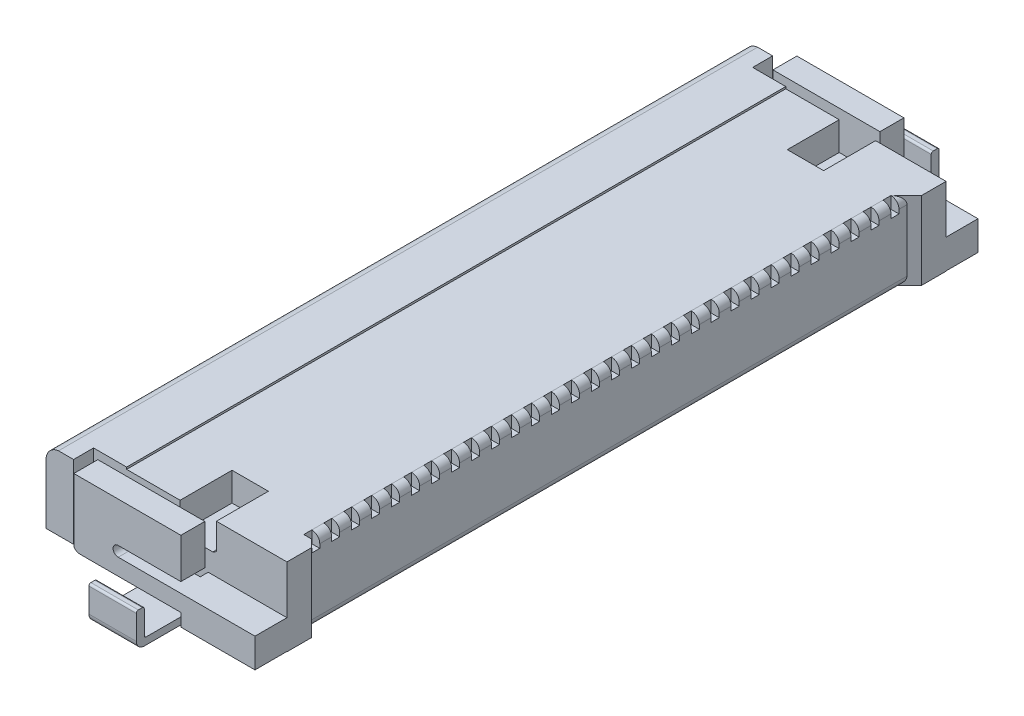
from build123d import *

# Parameters (mm, degrees)
BOSS_EXTRUDE1_DEPTH  = 0.6
BOSS_EXTRUDE2_DEPTH  = 0.8
SKETCH8_W            = 1.187106534
SKETCH8_H            = 0.413578876
BOSS_EXTRUDE3_DEPTH  = 0.6
BOSS_EXTRUDE5_DEPTH  = 1.999195913
CUT_EXTRUDE6_DEPTH   = 1.3
SKETCH19_W           = 8.25
SKETCH19_H           = 1.999195913
BOSS_EXTRUDE6_DEPTH  = 0.963004
BOSS_EXTRUDE7_DEPTH  = 8.25
CUT_EXTRUDE7_DEPTH   = 8.25
BOSS_EXTRUDE8_DEPTH  = 0.5
CUT_EXTRUDE8_DEPTH   = 0.05
FILLET4_R            = 0.2
SKETCH25_W           = 0.960524303
SKETCH25_H           = 0.2
CUT_EXTRUDE9_DEPTH   = 0.3
BOSS_EXTRUDE9_DEPTH  = 1
SKETCH27_W           = 1.187106534
SKETCH27_H           = 0.682337146
BOSS_EXTRUDE10_DEPTH = 0.2
FILLET6_R            = 0.2
FILLET7_R            = 0.05
BOSS_EXTRUDE11_DEPTH = 1.187106534
FILLET6_OF_MIRROR6_R = 0.2
FILLET7_OF_MIRROR6_R = 0.05
FILLET8_R            = 0.05
FILLET9_R            = 0.05
CUT_EXTRUDE10_DEPTH  = 0.68797799
SKETCH31_W           = 0.2
SKETCH31_H           = 0.540396383
BOSS_EXTRUDE12_DEPTH = 0.05
SKETCH32_W           = 0.2
SKETCH32_H           = 0.13319307
BOSS_EXTRUDE13_DEPTH = 0.01
LPATTERN3_COUNT      = 30
LPATTERN3_PITCH      = 0.5


with BuildPart() as part:
    # Sketch5 → Boss-Extrude1 (new body)
    with BuildSketch(Plane.XY):
        with BuildLine():
            Line((1.03647469, 0.909619652), (1.03647469, 0.476981472))
            add(Edge.make_bspline(
                [(1.184733339, 0.385802819), (1.081992039, 0.388557453), (1.03647469, 0.476981472)],
                knots=[0, 0, 0, 1, 1, 1], degree=2))
            Line((1.184733339, 0.385802819), (2.412634415, 0.385802819))
            Line((2.412634415, 0.385802819), (2.412634415, 0.799381695))
            Line((2.412634415, 0.799381695), (2.14625929, 0.799381695))
            ThreePointArc((2.14625929, 0.799381695), (2.018862492, 0.926778494), (2.14625929, 1.054175292))
            Line((2.14625929, 1.054175292), (3.715556221, 1.054175292))
            Line((3.715556221, 1.054175292), (3.715556221, 1.297888432))
            Line((3.715556221, 1.297888432), (3.715556221, 2.059195913))
            Line((3.715556221, 2.059195913), (1.03647469, 2.059195913))
            Line((1.03647469, 2.059195913), (1.03647469, 1.21340623))
            Line((1.03647469, 1.21340623), (1.03647469, 0.909619652))
        make_face()
    boss_extrude1 = extrude(amount=-BOSS_EXTRUDE1_DEPTH)



with BuildPart() as body_2:
    # Sketch7 → Boss-Extrude2 (new body)
    with BuildSketch(Plane.XY):
        Polygon((3.715556221, 0.067073076), (5.570517707, 0.067073076), (5.570517707, 0.174952185), (5.570517707, 0.799381695), (3.599740949, 0.799381695), (3.599740949, 0.385802819), (3.715556221, 0.385802819), (3.715556221, 0.174952185), align=None)
    boss_extrude2 = extrude(amount=-BOSS_EXTRUDE2_DEPTH)


with BuildPart() as part_1:
    add(part.part)

    add(body_2.part)  # Boss-Extrude3 merges body 2
    # Sketch8 → Boss-Extrude3 (add)
    with BuildSketch(Plane.XY):
        with Locations((3.006187682, 0.592592257)):
            Rectangle(SKETCH8_W, SKETCH8_H)
    boss_extrude3 = extrude(amount=-BOSS_EXTRUDE3_DEPTH)

    # Sketch13 → Boss-Extrude5 (add)
    with BuildSketch(Plane(origin=(0, 0.06, 0), x_dir=(1, 0, 0), z_dir=(0, 1, 0))):
        Polygon((5.307650665, 9.05), (1.692449276, 9.05), (1.692449276, 0.8), (5.570517707, 0.8), (5.570517707, 1.413103506), (5.3880831, 1.595538113), (5.3880831, 9.05), align=None)
    boss_extrude5 = extrude(amount=BOSS_EXTRUDE5_DEPTH)

    # Sketch17 → Cut-Extrude6 (cut)
    with BuildSketch(Plane.XY.offset(-0.8)):
        Polygon((3.806395908, 1.34820616), (3.715556221, 1.297888432), (2.896280475, 1.297888432), (2.896280475, 2.059195913), (3.806395908, 2.059195913), align=None)
    cut_extrude6 = extrude(amount=-CUT_EXTRUDE6_DEPTH, mode=Mode.SUBTRACT)



with BuildPart() as body_2_2:
    # Sketch19 → Boss-Extrude6 (new body)
    with BuildSketch(Plane.ZY.offset(-1.692449276)):
        with Locations((-4.925, 1.059597956)):
            Rectangle(SKETCH19_W, SKETCH19_H)
    boss_extrude6 = extrude(amount=BOSS_EXTRUDE6_DEPTH)

    # Sketch18 → Boss-Extrude7 (add)
    with BuildSketch(Plane.XY.offset(-0.8)):
        with BuildLine():
            Line((0.041467015, 1.670216776), (0.041467015, 0.219865316))
            Line((0.041467015, 0.219865316), (0.729445005, 0.219865316))
            Line((0.729445005, 0.219865316), (0.729445005, 0.909619652))
            Line((0.729445005, 0.909619652), (0.729445005, 2.059195913))
            Line((0.729445005, 2.059195913), (0.352729657, 2.059195913))
            ThreePointArc((0.352729657, 2.059195913), (0.116538119, 1.929170948), (0.041467015, 1.670216776))
        make_face()
    boss_extrude7 = extrude(amount=-BOSS_EXTRUDE7_DEPTH)

    # Sketch20 → Cut-Extrude7 (cut)
    with BuildSketch(Plane.XY.offset(-0.8)):
        Polygon((1.03647469, 0.067073076), (1.03647469, 0.909619652), (0.729445005, 0.909619652), (0.729445005, 0.219865316), (0.729445005, 0.06), (0.729445005, -0.020267982), (1.03647469, -0.020267982), align=None)
    cut_extrude7 = extrude(amount=-CUT_EXTRUDE7_DEPTH, mode=Mode.SUBTRACT)

    # Sketch21 → Boss-Extrude8 (add)
    with BuildSketch(Plane.XY.offset(-0.8)):
        with BuildLine():
            Line((0.729445005, 0.219865316), (0.729445005, 0.909619652))
            Line((0.729445005, 0.909619652), (0.729445005, 2.059195913))
            Line((0.729445005, 2.059195913), (0.352729657, 2.059195913))
            ThreePointArc((0.352729657, 2.059195913), (0.116538119, 1.929170948), (0.041467015, 1.670216776))
            Line((0.041467015, 1.670216776), (0.041467015, 0.219865316))
            Line((0.041467015, 0.219865316), (0.729445005, 0.219865316))
        make_face()
    boss_extrude8 = extrude(amount=BOSS_EXTRUDE8_DEPTH)


with BuildPart() as part_2:
    add(part_1.part)

    add(body_2_2.part)  # Mirror1 merges body 2 2
    # Mirror1: Boss-Extrude1, Boss-Extrude2, Boss-Extrude3, Boss-Extrude5 across Plane3
    add(boss_extrude1.mirror(Plane.XY.offset(-9.05)))
    add(boss_extrude2.mirror(Plane.XY.offset(-9.05)))
    add(boss_extrude3.mirror(Plane.XY.offset(-9.05)))
    add(boss_extrude5.mirror(Plane.XY.offset(-9.05)))

    # Mirror1 2: Cut-Extrude6 across Plane3
    add(cut_extrude6.mirror(Plane.XY.offset(-9.05)), mode=Mode.SUBTRACT)

    # Mirror1 3: Boss-Extrude6, Boss-Extrude7 across Plane3
    add(boss_extrude6.mirror(Plane.XY.offset(-9.05)))
    add(boss_extrude7.mirror(Plane.XY.offset(-9.05)))

    # Mirror1 4: Cut-Extrude7 across Plane3
    add(cut_extrude7.mirror(Plane.XY.offset(-9.05)), mode=Mode.SUBTRACT)

    # Mirror1 5: Boss-Extrude8 across Plane3
    add(boss_extrude8.mirror(Plane.XY.offset(-9.05)))

    # Sketch22 → Cut-Extrude8 (cut)
    with BuildSketch(Plane(origin=(0, 2.059195913, 0), x_dir=(1, 0, 0), z_dir=(0, 1, 0))):
        Polygon((2.896280475, 17.3), (1.558180163, 17.3), (1.558180163, 0.8), (2.896280475, 0.8), (2.896280475, 2.1), (3.806395908, 2.1), (3.806395908, 0.8), (5.570517707, 0.8), (5.570517707, 1.413103506), (5.3880831, 1.595538113), (5.3880831, 16.504461887), (5.570517707, 16.686896494), (5.570517707, 17.3), (3.806395908, 17.3), (3.806395908, 16), (2.896280475, 16), align=None)
    extrude(amount=-CUT_EXTRUDE8_DEPTH, mode=Mode.SUBTRACT)

    # Fillet4
    fillet4_edges = [part_2.edges().sort_by_distance(p)[0] for p in [
        (5.3880831, 0.06, -9.05),
        (5.3880831, 2.009195913, -9.05),
    ]]
    fillet(fillet4_edges, radius=FILLET4_R)

    # Sketch25 → Cut-Extrude9 (cut)
    with BuildSketch(Plane(origin=(0, 2.009195913, 0), x_dir=(1, 0, 0), z_dir=(0, 1, 0))):
        with Locations((5.668345251, 15.704461887)):
            Rectangle(SKETCH25_W, SKETCH25_H)
        with Locations((5.668345251, 16.204461887)):
            Rectangle(SKETCH25_W, SKETCH25_H)
        with Locations((5.668345251, 15.204461887)):
            Rectangle(SKETCH25_W, SKETCH25_H)
        with Locations((5.668345251, 14.704461887)):
            Rectangle(SKETCH25_W, SKETCH25_H)
        with Locations((5.668345251, 14.204461887)):
            Rectangle(SKETCH25_W, SKETCH25_H)
        with Locations((5.668345251, 13.704461887)):
            Rectangle(SKETCH25_W, SKETCH25_H)
        with Locations((5.668345251, 13.204461887)):
            Rectangle(SKETCH25_W, SKETCH25_H)
        with Locations((5.668345251, 12.704461887)):
            Rectangle(SKETCH25_W, SKETCH25_H)
        with Locations((5.668345251, 12.204461887)):
            Rectangle(SKETCH25_W, SKETCH25_H)
        with Locations((5.668345251, 11.704461887)):
            Rectangle(SKETCH25_W, SKETCH25_H)
        with Locations((5.668345251, 11.204461887)):
            Rectangle(SKETCH25_W, SKETCH25_H)
        with Locations((5.668345251, 10.704461887)):
            Rectangle(SKETCH25_W, SKETCH25_H)
        with Locations((5.668345251, 10.204461887)):
            Rectangle(SKETCH25_W, SKETCH25_H)
        with Locations((5.668345251, 9.704461887)):
            Rectangle(SKETCH25_W, SKETCH25_H)
        with Locations((5.668345251, 9.204461887)):
            Rectangle(SKETCH25_W, SKETCH25_H)
        with Locations((5.668345251, 8.704461887)):
            Rectangle(SKETCH25_W, SKETCH25_H)
        with Locations((5.668345251, 8.204461887)):
            Rectangle(SKETCH25_W, SKETCH25_H)
        with Locations((5.668345251, 7.704461887)):
            Rectangle(SKETCH25_W, SKETCH25_H)
        with Locations((5.668345251, 7.204461887)):
            Rectangle(SKETCH25_W, SKETCH25_H)
        with Locations((5.668345251, 6.704461887)):
            Rectangle(SKETCH25_W, SKETCH25_H)
        with Locations((5.668345251, 6.204461887)):
            Rectangle(SKETCH25_W, SKETCH25_H)
        with Locations((5.668345251, 5.704461887)):
            Rectangle(SKETCH25_W, SKETCH25_H)
        with Locations((5.668345251, 5.204461887)):
            Rectangle(SKETCH25_W, SKETCH25_H)
        with Locations((5.668345251, 4.704461887)):
            Rectangle(SKETCH25_W, SKETCH25_H)
        with Locations((5.668345251, 4.204461887)):
            Rectangle(SKETCH25_W, SKETCH25_H)
        with Locations((5.668345251, 3.704461887)):
            Rectangle(SKETCH25_W, SKETCH25_H)
        with Locations((5.668345251, 3.204461887)):
            Rectangle(SKETCH25_W, SKETCH25_H)
        with Locations((5.668345251, 2.704461887)):
            Rectangle(SKETCH25_W, SKETCH25_H)
        with Locations((5.668345251, 2.204461887)):
            Rectangle(SKETCH25_W, SKETCH25_H)
        with Locations((5.668345251, 1.704461887)):
            Rectangle(SKETCH25_W, SKETCH25_H)
    extrude(amount=-CUT_EXTRUDE9_DEPTH, mode=Mode.SUBTRACT)



with BuildPart() as body_2_3:
    # Sketch26 → Boss-Extrude9 (new body)
    with BuildSketch(Plane.XY):
        Polygon((2.412634415, 0.174952185), (2.412634415, 0.067073076), (2.412634415, 0), (3.599740949, 0), (3.599740949, 0.067073076), (3.599740949, 0.174952185), align=None)
    boss_extrude9 = extrude(amount=BOSS_EXTRUDE9_DEPTH)

    # Sketch27 → Boss-Extrude10 (add)
    with BuildSketch(Plane.XY.offset(1)):
        with Locations((3.006187682, 0.516120758)):
            Rectangle(SKETCH27_W, SKETCH27_H)
    boss_extrude10 = extrude(amount=-BOSS_EXTRUDE10_DEPTH)

    # Fillet6
    fillet6_edges = [body_2_3.edges().sort_by_distance(p)[0] for p in [
        (3.006187682, 0, 1),
    ]]
    fillet(fillet6_edges, radius=FILLET6_R)

    # Fillet7
    fillet7_edges = [body_2_3.edges().sort_by_distance(p)[0] for p in [
        (3.006187682, 0.857289331, 0.8),
        (3.006187682, 0.857289331, 1),
    ]]
    fillet(fillet7_edges, radius=FILLET7_R)


with BuildPart() as part_3:
    add(part_2.part)

    add(body_2_3.part)  # Boss-Extrude11 merges body 2 3
    # Sketch28 → Boss-Extrude11 (add)
    with BuildSketch(Plane.ZY.offset(-2.412634415)):
        with BuildLine():
            Line((-0.8, 0.323306936), (-0.8, 0.139277214))
            ThreePointArc((-0.8, 0.139277214), (-0.690012763, 0.045403916), (-0.552725208, 0))
            Line((-0.552725208, 0), (0, 0))
            Line((0, 0), (0, 0.174952185))
            Line((0, 0.174952185), (-0.552725208, 0.174952185))
            ThreePointArc((-0.552725208, 0.174952185), (-0.689100625, 0.227898076), (-0.8, 0.323306936))
        make_face()
    boss_extrude11 = extrude(amount=-BOSS_EXTRUDE11_DEPTH)

    # Mirror6: Boss-Extrude9, Boss-Extrude10, Boss-Extrude11 across plane
    add(boss_extrude9.mirror(Plane.XY.offset(-9.05)))
    add(boss_extrude10.mirror(Plane.XY.offset(-9.05)))
    add(boss_extrude11.mirror(Plane.XY.offset(-9.05)))

    # Fillet6 of Mirror6
    fillet6_of_mirror6_edges = [part_3.edges().sort_by_distance(p)[0] for p in [
        (3.006187682, 0, -19.1),
    ]]
    fillet(fillet6_of_mirror6_edges, radius=FILLET6_OF_MIRROR6_R)

    # Fillet7 of Mirror6
    fillet7_of_mirror6_edges = [part_3.edges().sort_by_distance(p)[0] for p in [
        (3.006187682, 0.857289331, -18.9),
        (3.006187682, 0.857289331, -19.1),
    ]]
    fillet(fillet7_of_mirror6_edges, radius=FILLET7_OF_MIRROR6_R)

    # Fillet8
    fillet8_edges = [part_3.edges().sort_by_distance(p)[0] for p in [
        (3.006187682, 0.174952185, 0.8),
    ]]
    fillet(fillet8_edges, radius=FILLET8_R)

    # Fillet9
    fillet9_edges = [part_3.edges().sort_by_distance(p)[0] for p in [
        (3.006187682, 0.174952185, -18.9),
    ]]
    fillet(fillet9_edges, radius=FILLET9_R)

    # Sketch30 → Cut-Extrude10 (cut)
    with BuildSketch(Plane.ZY.offset(-0.041467015)):
        Polygon((-15.469707526, 0.909619652), (-16.8, 0.909619652), (-16.8, 0.219865316), (-9.05, 0.219865316), (-9.05, 1.228773627), (-15.469707526, 1.228773627), align=None)
        Polygon((-9.05, 1.228773627), (-9.05, 0.219865316), (-1.3, 0.219865316), (-1.3, 0.909619652), (-2.630292474, 0.909619652), (-2.630292474, 1.228773627), align=None)
    extrude(amount=-CUT_EXTRUDE10_DEPTH, mode=Mode.SUBTRACT)

    # Sketch31 → Boss-Extrude12 (add)
    with BuildSketch(Plane.ZY.offset(-1.03647469)):
        with Locations((-16.25, 0.639421461)):
            Rectangle(SKETCH31_W, SKETCH31_H)
        with Locations((-15.75, 0.639421461)):
            Rectangle(SKETCH31_W, SKETCH31_H)
        with Locations((-15.25, 0.639421461)):
            Rectangle(SKETCH31_W, SKETCH31_H)
        with Locations((-14.75, 0.639421461)):
            Rectangle(SKETCH31_W, SKETCH31_H)
        with Locations((-14.25, 0.639421461)):
            Rectangle(SKETCH31_W, SKETCH31_H)
        with Locations((-13.75, 0.639421461)):
            Rectangle(SKETCH31_W, SKETCH31_H)
        with Locations((-13.25, 0.639421461)):
            Rectangle(SKETCH31_W, SKETCH31_H)
        with Locations((-12.75, 0.639421461)):
            Rectangle(SKETCH31_W, SKETCH31_H)
        with Locations((-12.25, 0.639421461)):
            Rectangle(SKETCH31_W, SKETCH31_H)
        with Locations((-11.75, 0.639421461)):
            Rectangle(SKETCH31_W, SKETCH31_H)
        with Locations((-11.25, 0.639421461)):
            Rectangle(SKETCH31_W, SKETCH31_H)
        with Locations((-10.75, 0.639421461)):
            Rectangle(SKETCH31_W, SKETCH31_H)
        with Locations((-10.25, 0.639421461)):
            Rectangle(SKETCH31_W, SKETCH31_H)
        with Locations((-9.75, 0.639421461)):
            Rectangle(SKETCH31_W, SKETCH31_H)
        with Locations((-9.25, 0.639421461)):
            Rectangle(SKETCH31_W, SKETCH31_H)
        with Locations((-8.75, 0.639421461)):
            Rectangle(SKETCH31_W, SKETCH31_H)
        with Locations((-8.25, 0.639421461)):
            Rectangle(SKETCH31_W, SKETCH31_H)
        with Locations((-7.75, 0.639421461)):
            Rectangle(SKETCH31_W, SKETCH31_H)
        with Locations((-7.25, 0.639421461)):
            Rectangle(SKETCH31_W, SKETCH31_H)
        with Locations((-6.75, 0.639421461)):
            Rectangle(SKETCH31_W, SKETCH31_H)
        with Locations((-6.25, 0.639421461)):
            Rectangle(SKETCH31_W, SKETCH31_H)
        with Locations((-5.75, 0.639421461)):
            Rectangle(SKETCH31_W, SKETCH31_H)
        with Locations((-5.25, 0.639421461)):
            Rectangle(SKETCH31_W, SKETCH31_H)
        with Locations((-4.75, 0.639421461)):
            Rectangle(SKETCH31_W, SKETCH31_H)
        with Locations((-4.25, 0.639421461)):
            Rectangle(SKETCH31_W, SKETCH31_H)
        with Locations((-3.75, 0.639421461)):
            Rectangle(SKETCH31_W, SKETCH31_H)
        with Locations((-1.75, 0.639421461)):
            Rectangle(SKETCH31_W, SKETCH31_H)
        with Locations((-2.25, 0.639421461)):
            Rectangle(SKETCH31_W, SKETCH31_H)
        with Locations((-2.75, 0.639421461)):
            Rectangle(SKETCH31_W, SKETCH31_H)
        with Locations((-3.25, 0.639421461)):
            Rectangle(SKETCH31_W, SKETCH31_H)
    extrude(amount=BOSS_EXTRUDE12_DEPTH)

    # Sketch32 → Boss-Extrude13 (add)
    with BuildSketch(Plane.ZY.offset(-0.98647469)):
        with Locations((-16.25, 0.706017995)):
            Rectangle(SKETCH32_W, SKETCH32_H)
    boss_extrude13 = extrude(amount=BOSS_EXTRUDE13_DEPTH)

    # LPattern3: Boss-Extrude13 ×30
    with Locations(*[(0, 0, i * LPATTERN3_PITCH) for i in range(1, LPATTERN3_COUNT)]):
        add(boss_extrude13)


solid = part_3.part
